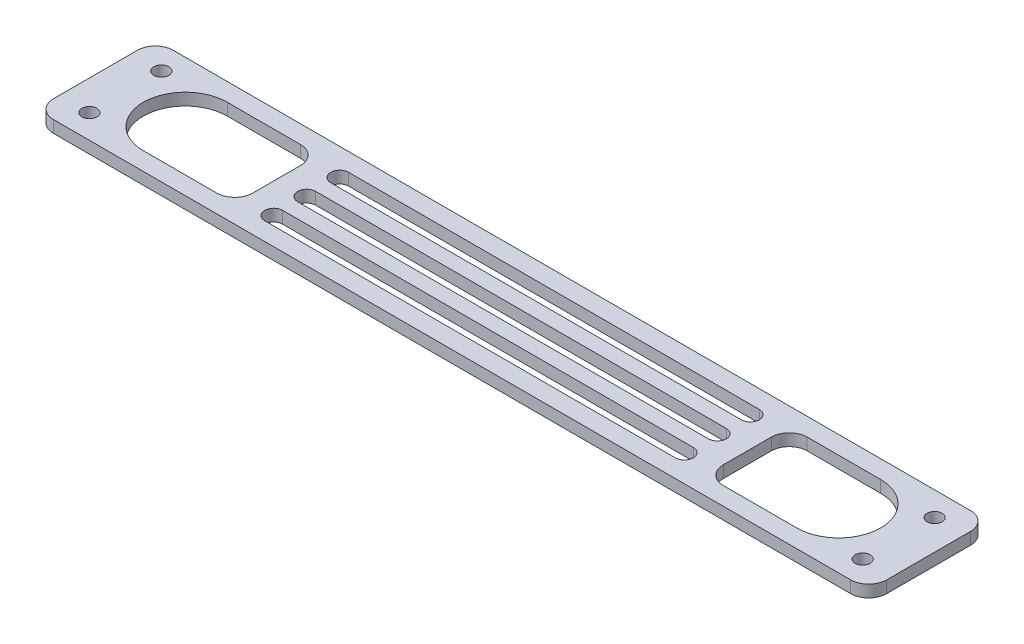
from build123d import *

# Parameters (mm, degrees)
EXTRUDE_1_DEPTH          = 2
HOLE_WIZARD_1_D          = 2.5
CUT_EXTRUDE_1_DEPTH      = 71.244216844
EXTRUDE_2_DEPTH          = 2
CUT_EXTRUDE_2_DEPTH      = 71.244216844
CUT_EXTRUDE_2_DEPTH_BACK = 71.244216844


with BuildPart() as part:
    # 草图1 → 凸台-拉伸1 (new body)
    with BuildSketch(Plane(origin=(0, 0, 0), x_dir=(1, 0, 0), z_dir=(0, 1, 0))):
        with BuildLine():
            Line((66.5, 10), (-66.5, 10))
            ThreePointArc((-66.5, 10), (-68.621320344, 9.121320344), (-69.5, 7))
            Line((-69.5, 7), (-69.5, -7))
            ThreePointArc((-69.5, -7), (-68.621320344, -9.121320344), (-66.5, -10))
            Line((-66.5, -10), (66.5, -10))
            ThreePointArc((66.5, -10), (68.621320344, -9.121320344), (69.5, -7))
            Line((69.5, -7), (69.5, 7))
            ThreePointArc((69.5, 7), (68.621320344, 9.121320344), (66.5, 10))
        make_face()
    extrude(amount=EXTRUDE_1_DEPTH)

    # 孔1 (through all)
    with Locations(Plane(origin=(0, 2, 0), x_dir=(1, 0, 0), z_dir=(0, 1, 0))):
        with Locations((-64.5, 6), (-64.5, -6), (64.5, -6), (64.5, 6)):
            Hole(HOLE_WIZARD_1_D / 2)

    # 草图5 → 切除-拉伸1 (cut, through all)
    with BuildSketch(Plane(origin=(0, 2, 0), x_dir=(1, 0, 0), z_dir=(0, 1, 0))):
        with BuildLine():
            Line((-54.5, 7), (54.5, 7))
            ThreePointArc((54.5, 7), (61.5, 0), (54.5, -7))
            Line((54.5, -7), (-54.5, -7))
            ThreePointArc((-54.5, -7), (-61.5, 0), (-54.5, 7))
        make_face()
    extrude(amount=-CUT_EXTRUDE_1_DEPTH, mode=Mode.SUBTRACT)

    # 草图6 → 凸台-拉伸2 (add)
    with BuildSketch(Plane.XZ):
        with BuildLine():
            Line((-39.25, -10), (39.25, -10))
            Line((39.25, -10), (46.785993788, -7))
            Line((46.785993788, -7), (42.25, -7))
            ThreePointArc((42.25, -7), (40.128679656, -6.121320344), (39.25, -4))
            Line((39.25, -4), (39.25, 4))
            ThreePointArc((39.25, 4), (40.128679656, 6.121320344), (42.25, 7))
            Line((42.25, 7), (46.785993788, 7))
            Line((46.785993788, 7), (39.25, 10))
            Line((39.25, 10), (-39.25, 10))
            Line((-39.25, 10), (-46.785993788, 7))
            Line((-46.785993788, 7), (-42.25, 7))
            ThreePointArc((-42.25, 7), (-40.128679656, 6.121320344), (-39.25, 4))
            Line((-39.25, 4), (-39.25, -4))
            ThreePointArc((-39.25, -4), (-40.128679656, -6.121320344), (-42.25, -7))
            Line((-42.25, -7), (-46.49444439, -7))
            Line((-46.49444439, -7), (-39.25, -10))
        make_face()
    extrude(amount=-EXTRUDE_2_DEPTH)

    # 草图7 → 切除-拉伸2 (cut, two sides: drawn at the far end of the back side and taken through both)
    with BuildSketch(Plane.XZ.offset(-CUT_EXTRUDE_2_DEPTH_BACK)):
        with BuildLine():
            Line((34.25, -1.5), (-34.25, -1.5))
            ThreePointArc((-34.25, -1.5), (-35.75, 0), (-34.25, 1.5))
            Line((-34.25, 1.5), (34.25, 1.5))
            ThreePointArc((34.25, 1.5), (35.75, 0), (34.25, -1.5))
        make_face()
        with BuildLine():
            Line((34.25, 4), (-34.25, 4))
            ThreePointArc((-34.25, 4), (-35.75, 5.5), (-34.25, 7))
            Line((-34.25, 7), (34.25, 7))
            ThreePointArc((34.25, 7), (35.75, 5.5), (34.25, 4))
        make_face()
        with BuildLine():
            Line((34.25, -7), (-34.25, -7))
            ThreePointArc((-34.25, -7), (-35.75, -5.5), (-34.25, -4))
            Line((-34.25, -4), (34.25, -4))
            ThreePointArc((34.25, -4), (35.75, -5.5), (34.25, -7))
        make_face()
    extrude(amount=CUT_EXTRUDE_2_DEPTH + CUT_EXTRUDE_2_DEPTH_BACK, mode=Mode.SUBTRACT)


solid = part.part
